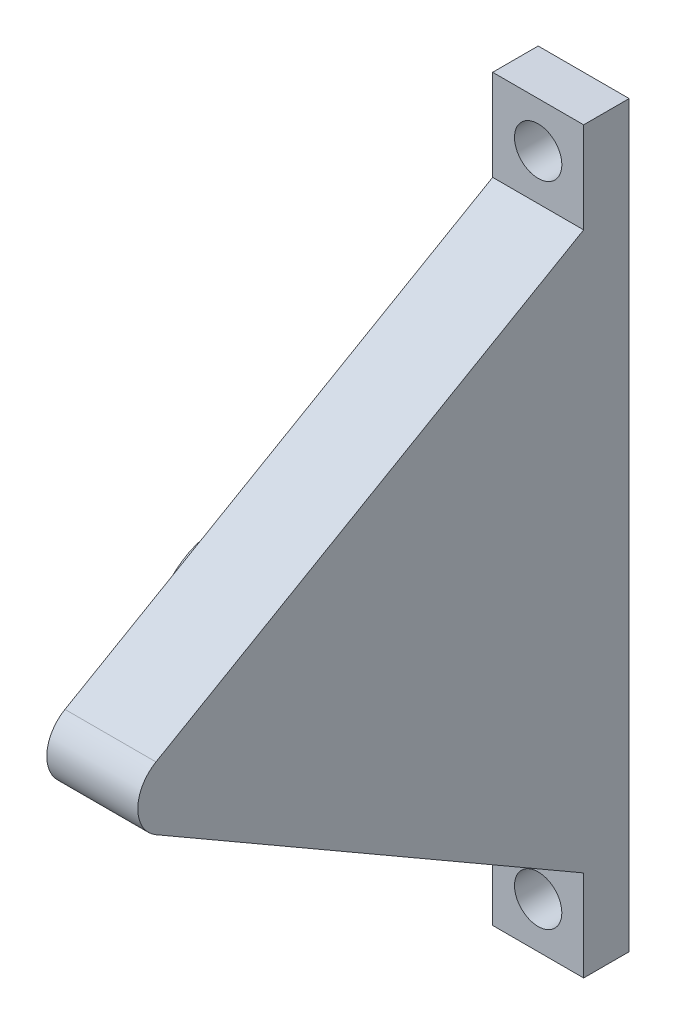
from build123d import *

# Parameters (mm, degrees)
BOSS_EXTRUDE1_DEPTH = 12.7
SKETCH3_R           = 9.398
BOSS_EXTRUDE2_DEPTH = 6.35
SKETCH4_R           = 3.302
CUT_EXTRUDE1_DEPTH  = 122.11231981


with BuildPart() as part:
    # Sketch2 → Boss-Extrude1 (new body)
    with BuildSketch(Plane(origin=(0, 0, 0), x_dir=(0, 0, -1), z_dir=(1, 0, 0))):
        with BuildLine():
            Line((0, -103.122893238), (0, 0))
            Line((0, 0), (-6.35, 0))
            Line((-6.35, 0), (-6.35, -12.7))
            Line((-6.35, -12.7), (-66.04, -47.162037568))
            ThreePointArc((-66.04, -47.162037568), (-68.58, -51.561446619), (-66.04, -55.96085567))
            Line((-66.04, -55.96085567), (-6.35, -90.422893238))
            Line((-6.35, -90.422893238), (-6.35, -103.122893238))
            Line((-6.35, -103.122893238), (0, -103.122893238))
        make_face()
    extrude(amount=BOSS_EXTRUDE1_DEPTH)

    # Sketch3 → Boss-Extrude2 (add)
    with BuildSketch(Plane.ZY):
        with Locations((38.1, -51.561446619)):
            Circle(SKETCH3_R)
    extrude(amount=BOSS_EXTRUDE2_DEPTH)

    # Sketch4 → Cut-Extrude1 (cut, through all)
    with BuildSketch(Plane.XY.offset(6.35)):
        with Locations((6.35, -96.772893238)):
            Circle(SKETCH4_R)
        with Locations((6.35, -6.35)):
            Circle(SKETCH4_R)
    extrude(amount=-CUT_EXTRUDE1_DEPTH, mode=Mode.SUBTRACT)


solid = part.part
